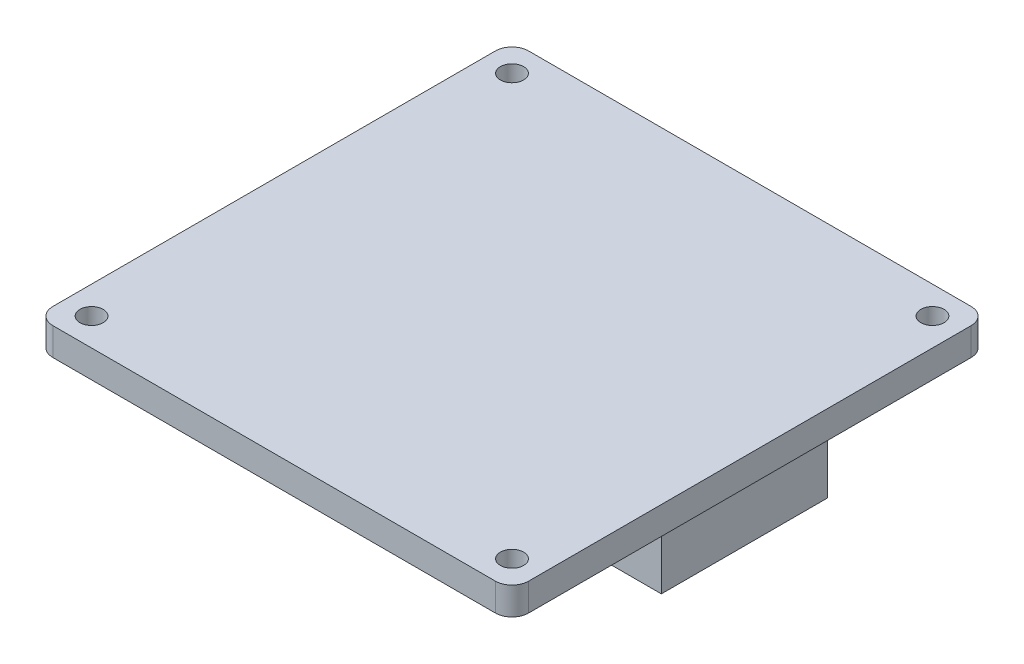
from build123d import *

# Parameters (mm, degrees)
SKETCH_1_R      = 2.1
EXTRUDE_1_DEPTH = 5
SKETCH_2_W      = 64
SKETCH_2_H      = 30
EXTRUDE_2_DEPTH = 20


with BuildPart() as part:
    # Эскиз1 → Бобышка-Вытянуть1 (new body)
    with BuildSketch(Plane(origin=(0, 0, 0), x_dir=(1, 0, 0), z_dir=(0, 1, 0))):
        with BuildLine():
            Line((-40.000093409, 43.000093409), (40.000093409, 43.000093409))
            ThreePointArc((40.000093409, 43.000093409), (42.121413752, 42.121413752), (43.000093409, 40.000093409))
            Line((43.000093409, 40.000093409), (43.000093409, -40.000093409))
            ThreePointArc((43.000093409, -40.000093409), (42.121413752, -42.121413752), (40.000093409, -43.000093409))
            Line((40.000093409, -43.000093409), (-40.000093409, -43.000093409))
            ThreePointArc((-40.000093409, -43.000093409), (-42.121413752, -42.121413752), (-43.000093409, -40.000093409))
            Line((-43.000093409, -40.000093409), (-43.000093409, 40.000093409))
            ThreePointArc((-43.000093409, 40.000093409), (-42.121413752, 42.121413752), (-40.000093409, 43.000093409))
        make_face()
        with Locations((-38, 38)):
            Circle(SKETCH_1_R, mode=Mode.SUBTRACT)
        with Locations((38, 38)):
            Circle(SKETCH_1_R, mode=Mode.SUBTRACT)
        with Locations((38, -38)):
            Circle(SKETCH_1_R, mode=Mode.SUBTRACT)
        with Locations((-38, -38)):
            Circle(SKETCH_1_R, mode=Mode.SUBTRACT)
    extrude(amount=EXTRUDE_1_DEPTH)

    # Эскиз2 → Бобышка-Вытянуть2 (add)
    with BuildSketch(Plane.XZ):
        with Locations((0, -10)):
            Rectangle(SKETCH_2_W, SKETCH_2_H)
    extrude(amount=EXTRUDE_2_DEPTH)


solid = part.part
